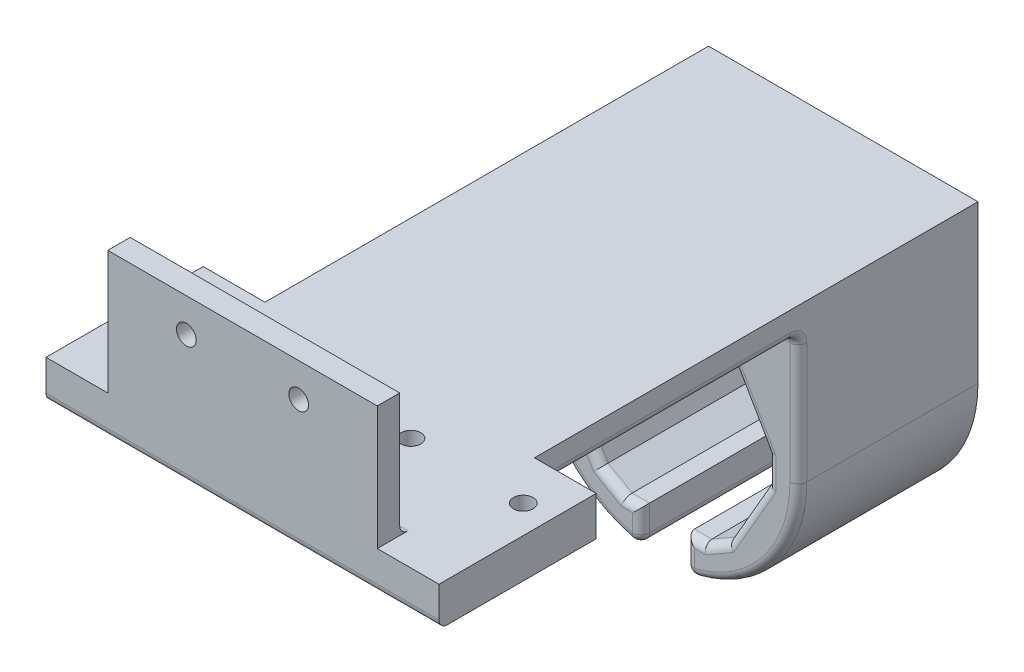
from build123d import *

# Parameters (mm, degrees)
SKETCH1_R                = 24
BOSS_EXTRUDE2_DEPTH      = 32
CUT_EXTRUDE1_DEPTH       = 28
CUT_EXTRUDE2_REACH       = 48.648
SKETCH3_W                = 8
SKETCH3_H                = 8
BOSS_EXTRUDE3_DEPTH      = 32
SKETCH6_W                = 48
SKETCH6_H                = 5
BOSS_EXTRUDE4_DEPTH      = 75
SKETCH7_W                = 48
SKETCH7_H                = 4
BOSS_EXTRUDE5_DEPTH      = 22
CUT_EXTRUDE3_REACH       = 118.983
SKETCH8_R                = 1.75
BOSS_EXTRUDE7_DEPTH      = 2
BOSS_EXTRUDE7_DEPTH_BACK = 5
SKETCH11_W               = 70
SKETCH11_H               = 28
CUT_EXTRUDE5_REACH       = 126.008
SKETCH12_R               = 1.75
CUT_EXTRUDE6_DEPTH       = 97.695398029
FILLET2_R                = 1.5
FILLET3_R                = 4


with BuildPart() as part:
    # Sketch1 → Boss-Extrude2 (new body)
    with BuildSketch(Plane(origin=(0, 0, 0), x_dir=(0, 1, 0), z_dir=(0, 0, 1))):
        with Locations(Location((0, 0, 0), (0, 0, 270))):
            Circle(SKETCH1_R)
    extrude(amount=BOSS_EXTRUDE2_DEPTH)

    # Sketch2 → Cut-Extrude1 (cut)
    with BuildSketch(Plane.XY.offset(32)):
        Polygon((7.09995, 17.23849547), (-7.09995, 17.23849547), (-11.379, 14.767984801), (-18.47895, 2.470510669), (-18.47895, -2.470510669), (-11.379, -14.767984801), (-7.09995, -17.23849547), (7.09995, -17.23849547), (11.379, -14.767984801), (18.47895, -2.470510669), (18.47895, 2.470510669), (11.379, 14.767984801), align=None)
    extrude(amount=-CUT_EXTRUDE1_DEPTH, mode=Mode.SUBTRACT)

    # Sketch3 → Cut-Extrude2 (cut, up to next)
    with BuildSketch(Plane(origin=(0, 0, 0), x_dir=(1, 0, 0), z_dir=(0, 0, -1)), mode=Mode.PRIVATE) as cut_extrude2_sk1:
        Rectangle(SKETCH3_W, SKETCH3_H)
    cut_extrude2_tool1 = extrude(cut_extrude2_sk1.sketch, amount=-CUT_EXTRUDE2_REACH, mode=Mode.PRIVATE) & part.part
    add(cut_extrude2_tool1.solids().sort_by_distance((0, 0, 0))[0], mode=Mode.SUBTRACT)

    # Sketch4 → Boss-Extrude3 (add)
    with BuildSketch(Plane.XY.offset(32)):
        with BuildLine():
            Line((-24, 0), (-24, 28))
            Line((-24, 28), (24, 28))
            Line((24, 28), (24, 0))
            Line((24, 0), (22, 0))
            ThreePointArc((22, 0), (0, 22), (-22, 0))
            Line((-22, 0), (-24, 0))
        make_face()
    extrude(amount=-BOSS_EXTRUDE3_DEPTH)

    # Sketch6 → Boss-Extrude4 (add)
    with BuildSketch(Plane.XY.offset(32)):
        with Locations((0, 25.5)):
            Rectangle(SKETCH6_W, SKETCH6_H)
    extrude(amount=BOSS_EXTRUDE4_DEPTH)

    # Sketch7 → Boss-Extrude5 (add)
    with BuildSketch(Plane(origin=(0, 28, 0), x_dir=(-1, 0, 0), z_dir=(0, 1, 0))):
        with Locations((0, 105)):
            Rectangle(SKETCH7_W, SKETCH7_H)
    extrude(amount=BOSS_EXTRUDE5_DEPTH)

    # Sketch8 → Cut-Extrude3 (cut, up to next)
    with BuildSketch(Plane(origin=(0, 0, 103), x_dir=(1, 0, 0), z_dir=(0, 0, -1)), mode=Mode.PRIVATE) as cut_extrude3_sk1:
        with Locations(Location((-10, -44, 0), (0, 0, 180))):
            Circle(SKETCH8_R)
    cut_extrude3_tool1 = extrude(cut_extrude3_sk1.sketch, amount=-CUT_EXTRUDE3_REACH, mode=Mode.PRIVATE) & part.part
    # Sketch8 → Cut-Extrude3 (cut, up to next)
    with BuildSketch(Plane(origin=(0, 0, 103), x_dir=(1, 0, 0), z_dir=(0, 0, -1)), mode=Mode.PRIVATE) as cut_extrude3_sk2:
        with Locations((10, -44)):
            Circle(SKETCH8_R)
    cut_extrude3_tool2 = extrude(cut_extrude3_sk2.sketch, amount=-CUT_EXTRUDE3_REACH, mode=Mode.PRIVATE) & part.part
    add(cut_extrude3_tool1.solids().sort_by_distance((-10, 44, 103))[0], mode=Mode.SUBTRACT)
    add(cut_extrude3_tool2.solids().sort_by_distance((10, 44, 103))[0], mode=Mode.SUBTRACT)

    # Sketch11 → Boss-Extrude7 (add, two sides: drawn at the far end of the back side and taken through both)
    with BuildSketch(Plane.XZ.offset(-23).offset(-BOSS_EXTRUDE7_DEPTH_BACK)):
        with Locations((0, 93)):
            Rectangle(SKETCH11_W, SKETCH11_H)
    extrude(amount=BOSS_EXTRUDE7_DEPTH + BOSS_EXTRUDE7_DEPTH_BACK)

    # Sketch12 → Cut-Extrude5 (cut, up to next)
    with BuildSketch(Plane(origin=(0, 28, 0), x_dir=(-1, 0, 0), z_dir=(0, 1, 0)), mode=Mode.PRIVATE) as cut_extrude5_sk1:
        with Locations(Location((-10, 87, 0), (0, 0, 90))):
            Circle(SKETCH12_R)
    cut_extrude5_tool1 = extrude(cut_extrude5_sk1.sketch, amount=-CUT_EXTRUDE5_REACH, mode=Mode.PRIVATE) & part.part
    # Sketch12 → Cut-Extrude5 (cut, up to next)
    with BuildSketch(Plane(origin=(0, 28, 0), x_dir=(-1, 0, 0), z_dir=(0, 1, 0)), mode=Mode.PRIVATE) as cut_extrude5_sk2:
        with Locations(Location((-30, 87, 0), (0, 0, 90))):
            Circle(SKETCH12_R)
    cut_extrude5_tool2 = extrude(cut_extrude5_sk2.sketch, amount=-CUT_EXTRUDE5_REACH, mode=Mode.PRIVATE) & part.part
    # Sketch12 → Cut-Extrude5 (cut, up to next)
    with BuildSketch(Plane(origin=(0, 28, 0), x_dir=(-1, 0, 0), z_dir=(0, 1, 0)), mode=Mode.PRIVATE) as cut_extrude5_sk3:
        with Locations(Location((10, 87, 0), (0, 0, 270))):
            Circle(SKETCH12_R)
    cut_extrude5_tool3 = extrude(cut_extrude5_sk3.sketch, amount=-CUT_EXTRUDE5_REACH, mode=Mode.PRIVATE) & part.part
    # Sketch12 → Cut-Extrude5 (cut, up to next)
    with BuildSketch(Plane(origin=(0, 28, 0), x_dir=(-1, 0, 0), z_dir=(0, 1, 0)), mode=Mode.PRIVATE) as cut_extrude5_sk4:
        with Locations(Location((30, 87, 0), (0, 0, 270))):
            Circle(SKETCH12_R)
    cut_extrude5_tool4 = extrude(cut_extrude5_sk4.sketch, amount=-CUT_EXTRUDE5_REACH, mode=Mode.PRIVATE) & part.part
    add(cut_extrude5_tool1.solids().sort_by_distance((10, 28, 87))[0], mode=Mode.SUBTRACT)
    add(cut_extrude5_tool2.solids().sort_by_distance((30, 28, 87))[0], mode=Mode.SUBTRACT)
    add(cut_extrude5_tool3.solids().sort_by_distance((-10, 28, 87))[0], mode=Mode.SUBTRACT)
    add(cut_extrude5_tool4.solids().sort_by_distance((-30, 28, 87))[0], mode=Mode.SUBTRACT)

    # Sketch13 → Cut-Extrude6 (cut, through all)
    with BuildSketch(Plane.XY.offset(32)):
        with BuildLine():
            Line((-4, -4), (-4, -23.664319132))
            ThreePointArc((-4, -23.664319132), (0, -24), (4, -23.664319132))
            Line((4, -23.664319132), (4, -4))
            Line((4, -4), (-4, -4))
        make_face()
    extrude(amount=-CUT_EXTRUDE6_DEPTH, mode=Mode.SUBTRACT)

    # Fillet2
    fillet2_edges = [part.edges().sort_by_distance(p)[0] for p in [
        (24, 23, 55.5),
        (-24, 23, 55.5),
        (0, 21, 107),
        (-9.239475, 16.003240135, 32),
        (-14.928975, 8.619247735, 32),
        (5.549975, -17.23849547, 32),
        (-18.47895, 0, 32),
        (18.33030278, -15.491933385, 32),
        (-14.928975, -8.619247735, 32),
        (-4, -20.451407301, 32),
        (4, -20.451407301, 32),
        (-9.239475, -16.003240135, 32),
        (4, -23.664319132, 16),
        (-4, -23.664319132, 16),
        (-5.549975, -17.23849547, 32),
        (9.239475, -16.003240135, 32),
        (14.928975, -8.619247735, 32),
        (18.47895, 0, 32),
        (14.928975, 8.619247735, 32),
        (9.239475, 16.003240135, 32),
        (0, 17.23849547, 32),
        (-18.33030278, -15.491933385, 32),
        (24, 11.5, 32),
        (-24, 11.5, 32),
        (0, 23, 32),
        (0, 28, 103),
    ]]
    fillet(fillet2_edges, radius=FILLET2_R)

    # Fillet3
    fillet3_edges = [part.edges().sort_by_distance(p)[0] for p in [
        (-4, 4, 2),
        (4, 4, 2),
    ]]
    fillet(fillet3_edges, radius=FILLET3_R - 0.0001)  # a hair under: the kernel refuses the full size


solid = part.part
